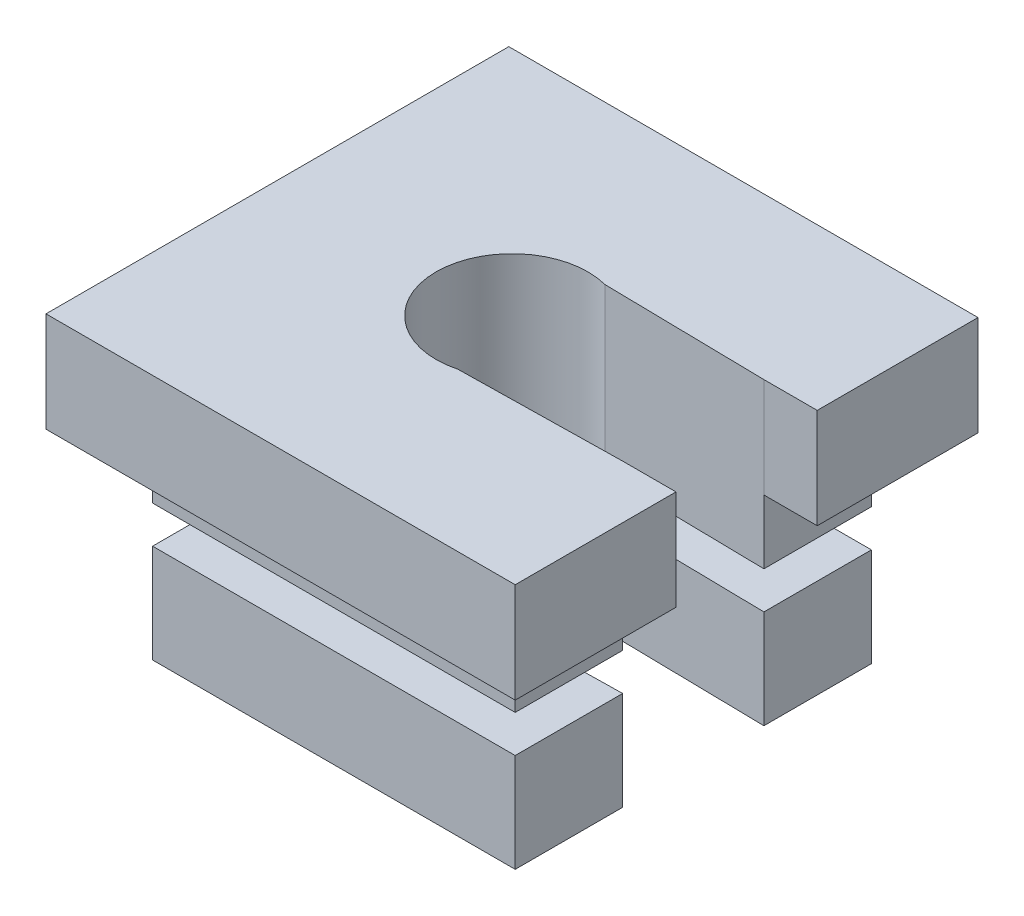
from build123d import *

# Parameters (mm, degrees)
BOSS_EXTRUDE1_DEPTH = 9.525
BOSS_EXTRUDE2_DEPTH = 4.7625
CUT_EXTRUDE1_DEPTH  = 1.778


with BuildPart() as part:
    # Sketch2 → Boss-Extrude1 (new body)
    with BuildSketch(Plane(origin=(0, 0, 0), x_dir=(1, 0, 0), z_dir=(0, 1, 0))):
        with BuildLine():
            Line((8.64, 8.4876), (-8.64, 8.4876))
            Line((-8.64, 8.4876), (-8.64, -8.4876))
            Line((-8.64, -8.4876), (8.64, -8.4876))
            Line((8.64, -8.4876), (8.64, -3.3655))
            Line((8.64, -3.3655), (0.921517153, -3.500226619))
            ThreePointArc((0.921517153, -3.500226619), (-3.6195, 0), (0.921517153, 3.500226619))
            Line((0.921517153, 3.500226619), (8.64, 3.3655))
            Line((8.64, 3.3655), (8.64, 8.4876))
        make_face()
    extrude(amount=BOSS_EXTRUDE1_DEPTH)

    # Sketch3 → Boss-Extrude2 (add)
    with BuildSketch(Plane(origin=(0, 9.525, 0), x_dir=(1, 0, 0), z_dir=(0, 1, 0))):
        with BuildLine():
            Line((11.18, 3.3655), (11.18, 11.0276))
            Line((11.18, 11.0276), (-11.18, 11.0276))
            Line((-11.18, 11.0276), (-11.18, -11.0276))
            Line((-11.18, -11.0276), (11.18, -11.0276))
            Line((11.18, -11.0276), (11.18, -3.3655))
            Line((11.18, -3.3655), (8.64, -3.3655))
            Line((8.64, -3.3655), (0.921517153, -3.500226619))
            ThreePointArc((0.921517153, -3.500226619), (-3.6195, 0), (0.921517153, 3.500226619))
            Line((0.921517153, 3.500226619), (8.64, 3.3655))
            Line((8.64, 3.3655), (11.18, 3.3655))
        make_face()
    extrude(amount=BOSS_EXTRUDE2_DEPTH)

    # Sketch4 → Cut-Extrude1 (cut)
    with BuildSketch(Plane(origin=(0, 6.477, 0), x_dir=(-1, 0, 0), z_dir=(0, -1, 0))):
        with BuildLine():
            Line((-8.64, 8.4876), (-8.64, 3.3655))
            Line((-8.64, 3.3655), (-3.970210665, 3.447011476))
            ThreePointArc((-3.970210665, 3.447011476), (5.2578, 0), (-3.970210665, -3.447011476))
            Line((-3.970210665, -3.447011476), (-8.64, -3.3655))
            Line((-8.64, -3.3655), (-8.64, -8.4876))
            Line((-8.64, -8.4876), (8.64, -8.4876))
            Line((8.64, -8.4876), (8.64, 8.4876))
            Line((8.64, 8.4876), (-8.64, 8.4876))
        make_face()
    extrude(amount=CUT_EXTRUDE1_DEPTH, mode=Mode.SUBTRACT)


solid = part.part
